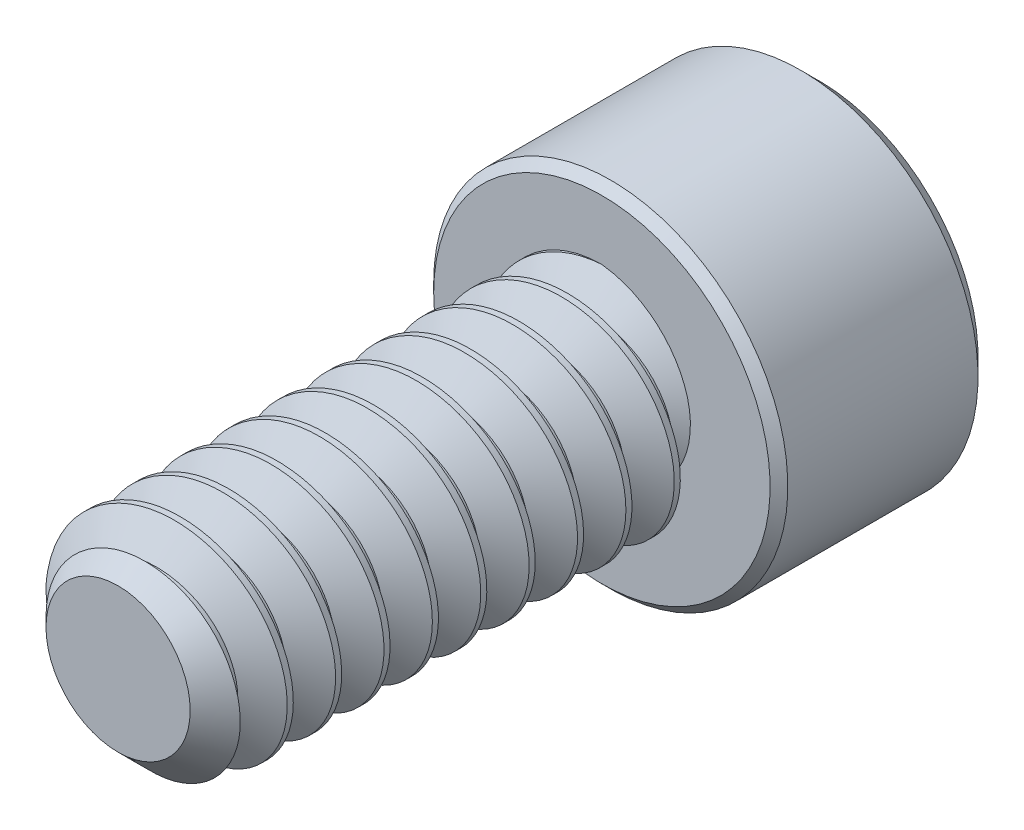
from build123d import *

# Parameters (mm, degrees)
SKETCH1_R          = 1.4224
EXTRUDE1_DEPTH     = 6.35
CHAMFER3_SIZE      = 0.47625
CUT_SWEEP1_PITCH   = 0.635
SKETCH6_R          = 2.3241
EXTRUDE2_DEPTH     = 2.8448
CUT_EXTRUDE1_DEPTH = 1.7859375
CHAMFER1_SIZE      = 0.23241
CHAMFER2_SIZE      = 0.116205


with BuildPart() as part:
    # Sketch1 → Extrude1 (new body)
    with BuildSketch(Plane.XY):
        Circle(SKETCH1_R)
    extrude(amount=-EXTRUDE1_DEPTH)

    # Chamfer3
    chamfer3_edges = [part.edges().sort_by_distance(p)[0] for p in [
        (-1.4224, 0, 0),
    ]]
    chamfer(chamfer3_edges, length=CHAMFER3_SIZE)

    # Cut-Sweep1: the profile of Sketch3 profile screwed along a right-hand helix of 11 turns, 6 arcs to a turn; built about Z, then put on its axis
    cut_sweep1_z = Axis((0, 0, 0), (0, 0, 1))
    cut_sweep1_corners = [(1.4227, 0, -0.555798205), (1.009955401, 0, -0.3175), (1.009955401, 0, -0.238125), (1.4227, 0, 0.000173205)]
    with BuildLine(mode=Mode.PRIVATE) as cut_sweep1_profile:
        Line(cut_sweep1_corners[0], cut_sweep1_corners[1])
        Line(cut_sweep1_corners[1], cut_sweep1_corners[2])
        Line(cut_sweep1_corners[2], cut_sweep1_corners[3])
        Line(cut_sweep1_corners[3], cut_sweep1_corners[0])
    cut_sweep1_cap = Face(cut_sweep1_profile.wire())
    cut_sweep1_turn_angles = [0, 30, 60, 90, 120, 150, 180, 210, 240, 270, 300, 330, 360]
    cut_sweep1_turn_weights = [1, 0.8660254037844387, 1, 0.8660254037844387, 1, 0.8660254037844387, 1, 0.8660254037844387, 1, 0.8660254037844387, 1, 0.8660254037844387, 1]
    cut_sweep1_turn_rails = [Edge.make_bspline([Vector(p[0], p[1], 0).rotate(cut_sweep1_z, cut_sweep1_turn_angles[k]) / cut_sweep1_turn_weights[k] + Vector(0, 0, p[2] + CUT_SWEEP1_PITCH * cut_sweep1_turn_angles[k] / 360) for k in range(13)], [0, 0, 0, 1, 1, 2, 2, 3, 3, 4, 4, 5, 5, 6, 6, 6], 2, cut_sweep1_turn_weights) for p in cut_sweep1_corners]
    cut_sweep1_turn_sides = [Face.make_surface_from_curves(cut_sweep1_turn_rails[p[0]], cut_sweep1_turn_rails[p[1]]) for p in [(0, 1), (1, 2), (2, 3), (3, 0)]]
    cut_sweep1 = Plane(origin=(0, 0, 0), x_dir=(0, 1, 0), z_dir=(0, 0, -1)) * Solid(Shell([*[p.moved(Location((0, 0, CUT_SWEEP1_PITCH * i))) for i in range(11) for p in cut_sweep1_turn_sides], cut_sweep1_cap, cut_sweep1_cap.rotate(cut_sweep1_z, 3960).moved(Location((0, 0, CUT_SWEEP1_PITCH * 3960 / 360)))]))
    add(cut_sweep1, mode=Mode.SUBTRACT)

    # Sketch6 → Extrude2 (add)
    with BuildSketch(Plane(origin=(0, 0, -6.35), x_dir=(-1, 0, 0), z_dir=(0, 0, -1))):
        Circle(SKETCH6_R)
    extrude(amount=EXTRUDE2_DEPTH)

    # Sketch7 → Cut-Extrude1 (cut)
    with BuildSketch(Plane(origin=(0, 0, -9.1948), x_dir=(-1, 0, 0), z_dir=(0, 0, -1))):
        Polygon((0, 1.374815329), (-1.190625, 0.687407664), (-1.190625, -0.687407664), (0, -1.374815329), (1.190625, -0.687407664), (1.190625, 0.687407664), align=None)
    extrude(amount=-CUT_EXTRUDE1_DEPTH, mode=Mode.SUBTRACT)

    # Cut-Extrude2 cone 1 section (through the dimple's axis) → Cut-Extrude2 (revolve, cut)
    with BuildSketch(Plane(origin=(0, 0, -9.1948), x_dir=(0, 1, 0), z_dir=(1, 0, 0))):
        Polygon((0, 0), (1.374815329, 0), (0, 1.374815329), align=None)
    revolve(axis=Axis((0, 0, -9.1948), (0, 0, 1)), mode=Mode.SUBTRACT)

    # Chamfer1
    chamfer1_edges = [part.edges().sort_by_distance(p)[0] for p in [
        (2.3241, 0, -9.1948),
    ]]
    chamfer(chamfer1_edges, length=CHAMFER1_SIZE)

    # Chamfer2
    chamfer2_edges = [part.edges().sort_by_distance(p)[0] for p in [
        (2.3241, 0, -6.35),
    ]]
    chamfer(chamfer2_edges, length=CHAMFER2_SIZE)


solid = part.part
